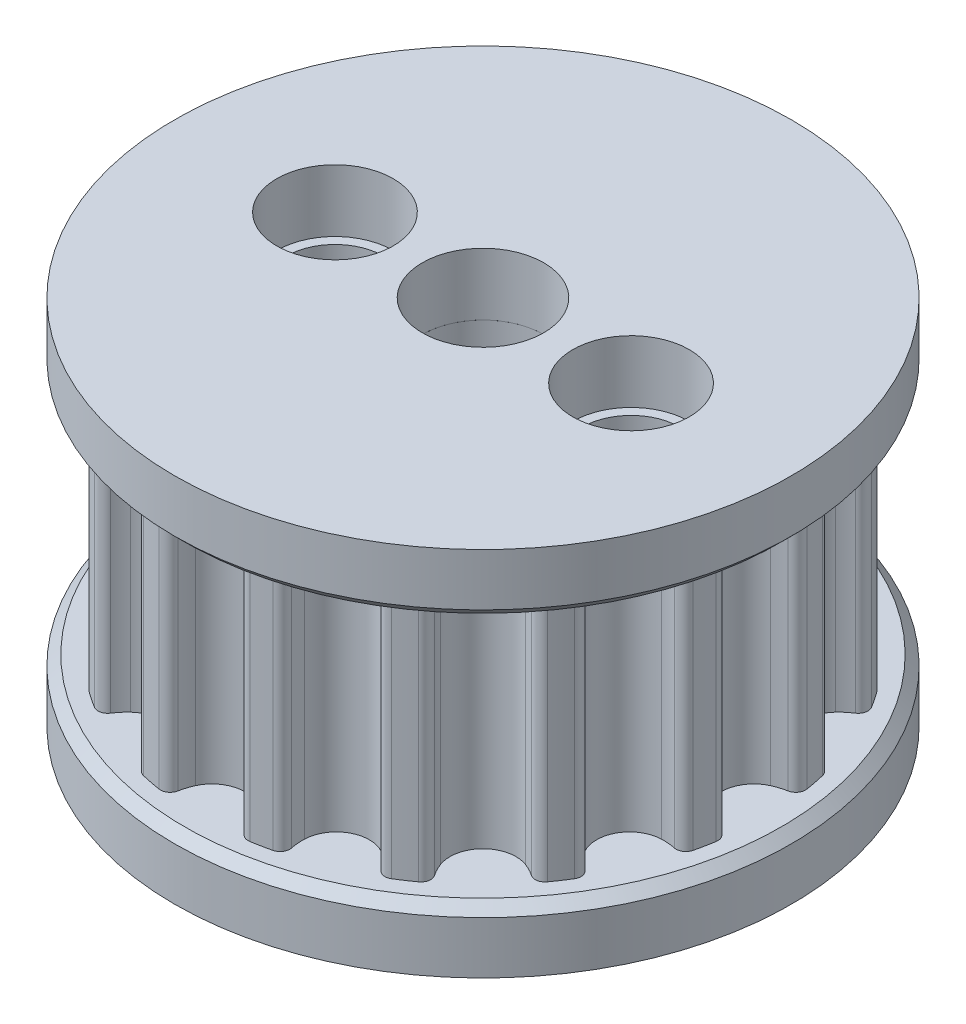
from build123d import *

# Parameters (mm, degrees)
SKETCH1_R           = 1.5625
BOSS_EXTRUDE1_DEPTH = 3.175
SKETCH2_R           = 7.9375
SKETCH2_R_2         = 1.5625
BOSS_EXTRUDE2_DEPTH = 1.6002
SKETCH3_R           = 1.5
CUT_EXTRUDE1_DEPTH  = 14.755489542
SKETCH4_R           = 1.25
CUT_EXTRUDE2_DEPTH  = 13.896910967
CHAMFER1_SIZE       = 0.254


with BuildPart() as part:
    # Sketch1 → Boss-Extrude1 (new, symmetric)
    with BuildSketch(Plane(origin=(0, 0, 0), x_dir=(1, 0, 0), z_dir=(0, 1, 0))):
        with BuildLine():
            ThreePointArc((-1.850768, -6.777037356), (-1.816941892, -6.962421006), (-1.663291889, -7.071521784))
            ThreePointArc((-1.663291889, -7.071521784), (-1.417233644, -7.124914669), (-1.169472895, -7.169748489))
            ThreePointArc((-1.169472895, -7.169748489), (-0.985767742, -7.127751824), (-0.883573242, -6.969424355))
            ThreePointArc((-0.883573242, -6.969424355), (-0.839120956, -6.792881518), (-0.773880597, -6.622919538))
            ThreePointArc((-0.773880597, -6.622919538), (0, -6.1245), (0.773880597, -6.622919538))
            ThreePointArc((0.773880597, -6.622919538), (0.839120956, -6.792881518), (0.883573242, -6.969424355))
            ThreePointArc((0.883573242, -6.969424355), (0.985767742, -7.127751824), (1.169472895, -7.169748489))
            ThreePointArc((1.169472895, -7.169748489), (1.417233644, -7.124914669), (1.663291889, -7.071521784))
            ThreePointArc((1.663291889, -7.071521784), (1.816941892, -6.962421006), (1.850768, -6.777037356))
            ThreePointArc((1.850768, -6.777037356), (1.824276538, -6.596921889), (1.819509137, -6.414931089))
            ThreePointArc((1.819509137, -6.414931089), (2.343744682, -5.658300197), (3.249454025, -5.822628523))
            ThreePointArc((3.249454025, -5.822628523), (3.374769892, -5.954686513), (3.483398468, -6.100779674))
            ThreePointArc((3.483398468, -6.100779674), (3.638403174, -6.20794704), (3.824196033, -6.176445981))
            ThreePointArc((3.824196033, -6.176445981), (4.035939958, -6.040210999), (4.242835561, -5.896719991))
            ThreePointArc((4.242835561, -5.896719991), (4.343038594, -5.737124705), (4.303346591, -5.552907854))
            ThreePointArc((4.303346591, -5.552907854), (4.209944466, -5.396640704), (4.135895098, -5.230327534))
            ThreePointArc((4.135895098, -5.230327534), (4.330675481, -4.330675481), (5.230327534, -4.135895098))
            ThreePointArc((5.230327534, -4.135895098), (5.396640704, -4.209944466), (5.552907854, -4.303346591))
            ThreePointArc((5.552907854, -4.303346591), (5.737124705, -4.343038594), (5.896719991, -4.242835561))
            ThreePointArc((5.896719991, -4.242835561), (6.040210999, -4.035939958), (6.176445981, -3.824196033))
            ThreePointArc((6.176445981, -3.824196033), (6.20794704, -3.638403174), (6.100779674, -3.483398468))
            ThreePointArc((6.100779674, -3.483398468), (5.954686513, -3.374769892), (5.822628523, -3.249454025))
            ThreePointArc((5.822628523, -3.249454025), (5.658300197, -2.343744682), (6.414931089, -1.819509137))
            ThreePointArc((6.414931089, -1.819509137), (6.596921889, -1.824276538), (6.777037356, -1.850768))
            ThreePointArc((6.777037356, -1.850768), (6.962421006, -1.816941892), (7.071521784, -1.663291889))
            ThreePointArc((7.071521784, -1.663291889), (7.124914669, -1.417233644), (7.169748489, -1.169472895))
            ThreePointArc((7.169748489, -1.169472895), (7.127751824, -0.985767742), (6.969424355, -0.883573242))
            ThreePointArc((6.969424355, -0.883573242), (6.792881518, -0.839120956), (6.622919538, -0.773880597))
            ThreePointArc((6.622919538, -0.773880597), (6.1245, 0), (6.622919538, 0.773880597))
            ThreePointArc((6.622919538, 0.773880597), (6.792881518, 0.839120956), (6.969424355, 0.883573242))
            ThreePointArc((6.969424355, 0.883573242), (7.127751824, 0.985767742), (7.169748489, 1.169472895))
            ThreePointArc((7.169748489, 1.169472895), (7.124914669, 1.417233644), (7.071521784, 1.663291889))
            ThreePointArc((7.071521784, 1.663291889), (6.962421006, 1.816941892), (6.777037356, 1.850768))
            ThreePointArc((6.777037356, 1.850768), (6.596921889, 1.824276538), (6.414931089, 1.819509137))
            ThreePointArc((6.414931089, 1.819509137), (5.658300197, 2.343744682), (5.822628523, 3.249454025))
            ThreePointArc((5.822628523, 3.249454025), (5.954686513, 3.374769892), (6.100779674, 3.483398468))
            ThreePointArc((6.100779674, 3.483398468), (6.20794704, 3.638403174), (6.176445981, 3.824196033))
            ThreePointArc((6.176445981, 3.824196033), (6.040210999, 4.035939958), (5.896719991, 4.242835561))
            ThreePointArc((5.896719991, 4.242835561), (5.737124705, 4.343038594), (5.552907854, 4.303346591))
            ThreePointArc((5.552907854, 4.303346591), (5.396640704, 4.209944466), (5.230327534, 4.135895098))
            ThreePointArc((5.230327534, 4.135895098), (4.330675481, 4.330675481), (4.135895098, 5.230327534))
            ThreePointArc((4.135895098, 5.230327534), (4.209944466, 5.396640704), (4.303346591, 5.552907854))
            ThreePointArc((4.303346591, 5.552907854), (4.343038594, 5.737124705), (4.242835561, 5.896719991))
            ThreePointArc((4.242835561, 5.896719991), (4.035939958, 6.040210999), (3.824196033, 6.176445981))
            ThreePointArc((3.824196033, 6.176445981), (3.638403174, 6.20794704), (3.483398468, 6.100779674))
            ThreePointArc((3.483398468, 6.100779674), (3.374769892, 5.954686513), (3.249454025, 5.822628523))
            ThreePointArc((3.249454025, 5.822628523), (2.343744682, 5.658300197), (1.819509137, 6.414931089))
            ThreePointArc((1.819509137, 6.414931089), (1.824276538, 6.596921889), (1.850768, 6.777037356))
            ThreePointArc((1.850768, 6.777037356), (1.816941892, 6.962421006), (1.663291889, 7.071521784))
            ThreePointArc((1.663291889, 7.071521784), (1.417233644, 7.124914669), (1.169472895, 7.169748489))
            ThreePointArc((1.169472895, 7.169748489), (0.985767742, 7.127751824), (0.883573242, 6.969424355))
            ThreePointArc((0.883573242, 6.969424355), (0.839120956, 6.792881518), (0.773880597, 6.622919538))
            ThreePointArc((0.773880597, 6.622919538), (0, 6.1245), (-0.773880597, 6.622919538))
            ThreePointArc((-0.773880597, 6.622919538), (-0.839120956, 6.792881518), (-0.883573242, 6.969424355))
            ThreePointArc((-0.883573242, 6.969424355), (-0.985767742, 7.127751824), (-1.169472895, 7.169748489))
            ThreePointArc((-1.169472895, 7.169748489), (-1.417233644, 7.124914669), (-1.663291889, 7.071521784))
            ThreePointArc((-1.663291889, 7.071521784), (-1.816941892, 6.962421006), (-1.850768, 6.777037356))
            ThreePointArc((-1.850768, 6.777037356), (-1.824276538, 6.596921889), (-1.819509137, 6.414931089))
            ThreePointArc((-1.819509137, 6.414931089), (-2.343744682, 5.658300197), (-3.249454025, 5.822628523))
            ThreePointArc((-3.249454025, 5.822628523), (-3.374769892, 5.954686513), (-3.483398468, 6.100779674))
            ThreePointArc((-3.483398468, 6.100779674), (-3.638403174, 6.20794704), (-3.824196033, 6.176445981))
            ThreePointArc((-3.824196033, 6.176445981), (-4.035939958, 6.040210999), (-4.242835561, 5.896719991))
            ThreePointArc((-4.242835561, 5.896719991), (-4.343038594, 5.737124705), (-4.303346591, 5.552907854))
            ThreePointArc((-4.303346591, 5.552907854), (-4.209944466, 5.396640704), (-4.135895098, 5.230327534))
            ThreePointArc((-4.135895098, 5.230327534), (-4.330675481, 4.330675481), (-5.230327534, 4.135895098))
            ThreePointArc((-5.230327534, 4.135895098), (-5.396640704, 4.209944466), (-5.552907854, 4.303346591))
            ThreePointArc((-5.552907854, 4.303346591), (-5.737124705, 4.343038594), (-5.896719991, 4.242835561))
            ThreePointArc((-5.896719991, 4.242835561), (-6.040210999, 4.035939958), (-6.176445981, 3.824196033))
            ThreePointArc((-6.176445981, 3.824196033), (-6.20794704, 3.638403174), (-6.100779674, 3.483398468))
            ThreePointArc((-6.100779674, 3.483398468), (-5.954686513, 3.374769892), (-5.822628523, 3.249454025))
            ThreePointArc((-5.822628523, 3.249454025), (-5.658300197, 2.343744682), (-6.414931089, 1.819509137))
            ThreePointArc((-6.414931089, 1.819509137), (-6.596921889, 1.824276538), (-6.777037356, 1.850768))
            ThreePointArc((-6.777037356, 1.850768), (-6.962421006, 1.816941892), (-7.071521784, 1.663291889))
            ThreePointArc((-7.071521784, 1.663291889), (-7.124914669, 1.417233644), (-7.169748489, 1.169472895))
            ThreePointArc((-7.169748489, 1.169472895), (-7.127751824, 0.985767742), (-6.969424355, 0.883573242))
            ThreePointArc((-6.969424355, 0.883573242), (-6.792881518, 0.839120956), (-6.622919538, 0.773880597))
            ThreePointArc((-6.622919538, 0.773880597), (-6.1245, 0), (-6.622919538, -0.773880597))
            ThreePointArc((-6.622919538, -0.773880597), (-6.792881518, -0.839120956), (-6.969424355, -0.883573242))
            ThreePointArc((-6.969424355, -0.883573242), (-7.127751824, -0.985767742), (-7.169748489, -1.169472895))
            ThreePointArc((-7.169748489, -1.169472895), (-7.124914669, -1.417233644), (-7.071521784, -1.663291889))
            ThreePointArc((-7.071521784, -1.663291889), (-6.962421006, -1.816941892), (-6.777037356, -1.850768))
            ThreePointArc((-6.777037356, -1.850768), (-6.596921889, -1.824276538), (-6.414931089, -1.819509137))
            ThreePointArc((-6.414931089, -1.819509137), (-5.658300197, -2.343744682), (-5.822628523, -3.249454025))
            ThreePointArc((-5.822628523, -3.249454025), (-5.954686513, -3.374769892), (-6.100779674, -3.483398468))
            ThreePointArc((-6.100779674, -3.483398468), (-6.20794704, -3.638403174), (-6.176445981, -3.824196033))
            ThreePointArc((-6.176445981, -3.824196033), (-6.040210999, -4.035939958), (-5.896719991, -4.242835561))
            ThreePointArc((-5.896719991, -4.242835561), (-5.737124705, -4.343038594), (-5.552907854, -4.303346591))
            ThreePointArc((-5.552907854, -4.303346591), (-5.396640704, -4.209944466), (-5.230327534, -4.135895098))
            ThreePointArc((-5.230327534, -4.135895098), (-4.330675481, -4.330675481), (-4.135895098, -5.230327534))
            ThreePointArc((-4.135895098, -5.230327534), (-4.209944466, -5.396640704), (-4.303346591, -5.552907854))
            ThreePointArc((-4.303346591, -5.552907854), (-4.343038594, -5.737124705), (-4.242835561, -5.896719991))
            ThreePointArc((-4.242835561, -5.896719991), (-4.035939958, -6.040210999), (-3.824196033, -6.176445981))
            ThreePointArc((-3.824196033, -6.176445981), (-3.638403174, -6.20794704), (-3.483398468, -6.100779674))
            ThreePointArc((-3.483398468, -6.100779674), (-3.374769892, -5.954686513), (-3.249454025, -5.822628523))
            ThreePointArc((-3.249454025, -5.822628523), (-2.343744682, -5.658300197), (-1.819509137, -6.414931089))
            ThreePointArc((-1.819509137, -6.414931089), (-1.824276538, -6.596921889), (-1.850768, -6.777037356))
        make_face()
        Circle(SKETCH1_R, mode=Mode.SUBTRACT)
    extrude(amount=BOSS_EXTRUDE1_DEPTH, both=True)

    # Sketch4 → Cut-Extrude2 (cut, through all)
    with BuildSketch(Plane.XZ.offset(3.175)):
        with Locations((-3.81, 0)):
            Circle(SKETCH4_R)
        with Locations((3.81, 0)):
            Circle(SKETCH4_R)
    extrude(amount=-CUT_EXTRUDE2_DEPTH, mode=Mode.SUBTRACT)


with BuildPart() as body_2:
    # Sketch2 → Boss-Extrude2 (new body)
    with BuildSketch(Plane.XZ.offset(3.175)):
        Circle(SKETCH2_R)
        Circle(SKETCH2_R_2, mode=Mode.SUBTRACT)
    extrude(amount=BOSS_EXTRUDE2_DEPTH)

    # Sketch3 → Cut-Extrude1 (cut, through all)
    with BuildSketch(Plane.XZ.offset(4.7752)):
        with Locations((-3.81, 0)):
            Circle(SKETCH3_R)
        with Locations((3.81, 0)):
            Circle(SKETCH3_R)
    extrude(amount=-CUT_EXTRUDE1_DEPTH, mode=Mode.SUBTRACT)

    # Chamfer1
    chamfer1_edges = [body_2.edges().sort_by_distance(p)[0] for p in [
        (-7.9375, -3.175, 0),
    ]]
    chamfer(chamfer1_edges, length=CHAMFER1_SIZE)


with BuildPart() as body_3:
    # Mirror2: mirrored copy
    add(body_2.part.mirror(Plane.ZX))


solid = Compound([part.part, body_2.part, body_3.part])
